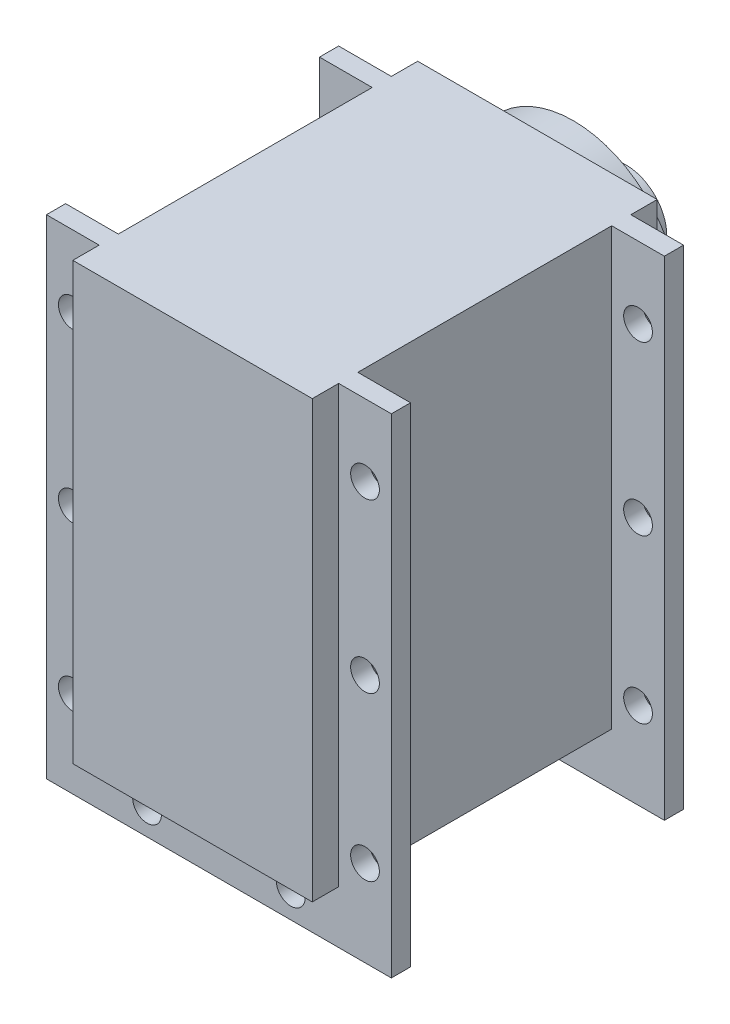
from build123d import *

# Parameters (mm, degrees)
SKETCH1_W           = 25
SKETCH1_H           = 45.5
BOSS_EXTRUDE1_DEPTH = 36
BOSS_EXTRUDE2_START = -2.75
SKETCH2_W           = 36
SKETCH2_H           = 51
SKETCH2_R           = 1.5
BOSS_EXTRUDE2_DEPTH = 2
SKETCH3_R           = 11
BOSS_EXTRUDE3_DEPTH = 3.75
SKETCH4_R           = 1.5
CUT_EXTRUDE1_DEPTH  = 3.75
SKETCH5_R           = 4.25
BOSS_EXTRUDE4_DEPTH = 5.5
BOSS_EXTRUDE5_START = -4.75
SKETCH6_W           = 36
SKETCH6_H           = 51
SKETCH6_R           = 1.5
BOSS_EXTRUDE5_DEPTH = 2


with BuildPart() as part:
    # Sketch1 → Boss-Extrude1 (new body)
    with BuildSketch(Plane.XY):
        Rectangle(SKETCH1_W, SKETCH1_H)
    extrude(amount=BOSS_EXTRUDE1_DEPTH)

    # Sketch2 → Boss-Extrude2 (add)
    with BuildSketch(Plane(origin=(0, 0, 0), x_dir=(-1, 0, 0), z_dir=(0, 0, -1)).offset(BOSS_EXTRUDE2_START)):
        with Locations((0, -2.75)):
            Rectangle(SKETCH2_W, SKETCH2_H)
        with Locations((-15.25, 15.25)):
            Circle(SKETCH2_R, mode=Mode.SUBTRACT)
        with Locations((-15.25, -2.25)):
            Circle(SKETCH2_R, mode=Mode.SUBTRACT)
        with Locations((-15.25, -19.25)):
            Circle(SKETCH2_R, mode=Mode.SUBTRACT)
        with Locations((-7.5, -25.5)):
            Circle(SKETCH2_R, mode=Mode.SUBTRACT)
        with Locations((7.5, -25.5)):
            Circle(SKETCH2_R, mode=Mode.SUBTRACT)
        with Locations((15.25, -19.25)):
            Circle(SKETCH2_R, mode=Mode.SUBTRACT)
        with Locations((15.25, -2.25)):
            Circle(SKETCH2_R, mode=Mode.SUBTRACT)
        with Locations((15.25, 15.25)):
            Circle(SKETCH2_R, mode=Mode.SUBTRACT)
    extrude(amount=-BOSS_EXTRUDE2_DEPTH)

    # Sketch3 → Boss-Extrude3 (add)
    with BuildSketch(Plane(origin=(0, 0, 0), x_dir=(-1, 0, 0), z_dir=(0, 0, -1))):
        with Locations((0, 10.75)):
            Circle(SKETCH3_R)
    extrude(amount=BOSS_EXTRUDE3_DEPTH)

    # Sketch4 → Cut-Extrude1 (cut)
    with BuildSketch(Plane(origin=(0, 0, -3.75), x_dir=(-1, 0, 0), z_dir=(0, 0, -1))):
        with Locations((0, 18.75)):
            Circle(SKETCH4_R)
        with Locations((-5.656854249, 16.406854249)):
            Circle(SKETCH4_R)
        with Locations((-8, 10.75)):
            Circle(SKETCH4_R)
        with Locations((-5.656854249, 5.093145751)):
            Circle(SKETCH4_R)
        with Locations((0, 2.75)):
            Circle(SKETCH4_R)
        with Locations((5.656854249, 5.093145751)):
            Circle(SKETCH4_R)
        with Locations((8, 10.75)):
            Circle(SKETCH4_R)
        with Locations((5.656854249, 16.406854249)):
            Circle(SKETCH4_R)
    extrude(amount=-CUT_EXTRUDE1_DEPTH, mode=Mode.SUBTRACT)

    # Sketch5 → Boss-Extrude4 (add)
    with BuildSketch(Plane(origin=(0, 0, -3.75), x_dir=(-1, 0, 0), z_dir=(0, 0, -1))):
        with Locations((0, 10.75)):
            Circle(SKETCH5_R)
    extrude(amount=BOSS_EXTRUDE4_DEPTH)

    # Sketch6 → Boss-Extrude5 (add)
    with BuildSketch(Plane.XY.offset(36).offset(BOSS_EXTRUDE5_START)):
        with Locations((0, -2.75)):
            Rectangle(SKETCH6_W, SKETCH6_H)
        with Locations((-15.25, 15.25)):
            Circle(SKETCH6_R, mode=Mode.SUBTRACT)
        with Locations((-15.25, -2.25)):
            Circle(SKETCH6_R, mode=Mode.SUBTRACT)
        with Locations((-15.25, -19.25)):
            Circle(SKETCH6_R, mode=Mode.SUBTRACT)
        with Locations((-7.5, -25.5)):
            Circle(SKETCH6_R, mode=Mode.SUBTRACT)
        with Locations((7.5, -25.5)):
            Circle(SKETCH6_R, mode=Mode.SUBTRACT)
        with Locations((15.25, -19.25)):
            Circle(SKETCH6_R, mode=Mode.SUBTRACT)
        with Locations((15.25, -2.25)):
            Circle(SKETCH6_R, mode=Mode.SUBTRACT)
        with Locations((15.25, 15.25)):
            Circle(SKETCH6_R, mode=Mode.SUBTRACT)
    extrude(amount=BOSS_EXTRUDE5_DEPTH)


solid = part.part
